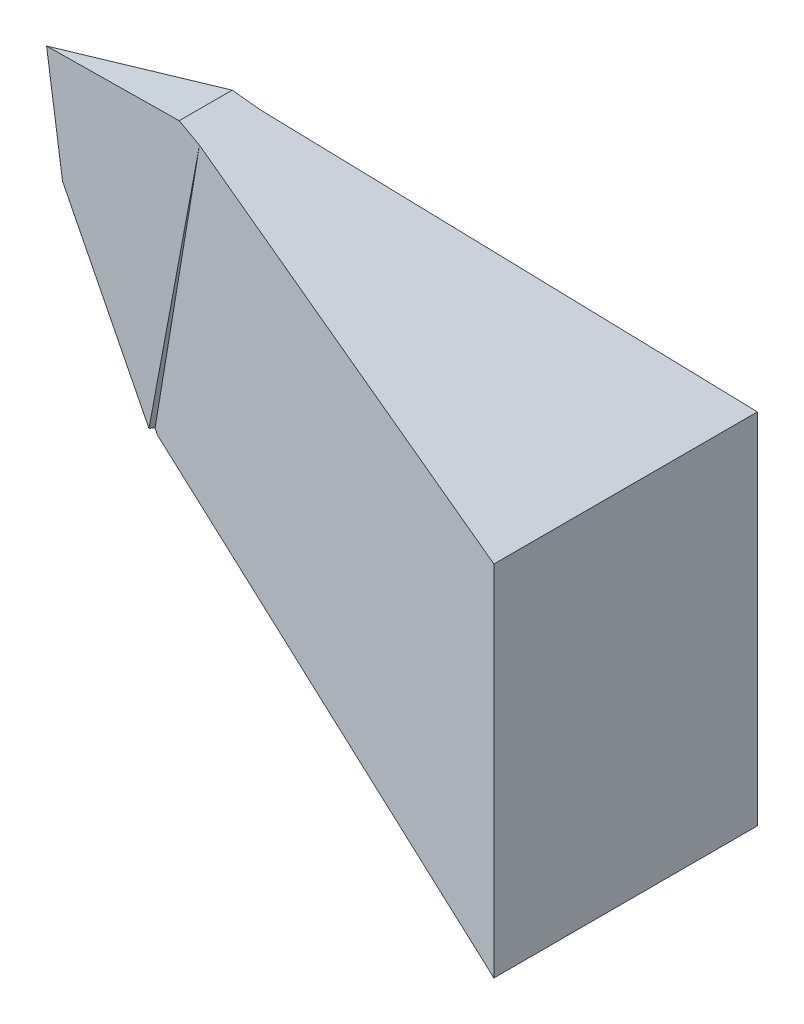
from build123d import *

# Parameters (mm, degrees)
BOSS_EXTRUDE1_DEPTH      = 821.33
BOSS_EXTRUDE1_DEPTH_BACK = 821.33
CUT_EXTRUDE1_DEPTH       = 1930.33
CUT_EXTRUDE2_DEPTH       = 3500.33
CUT_EXTRUDE4_DEPTH       = 3500.33


with BuildPart() as part:
    # Sketch1 → Boss-Extrude1 (new, two sides: drawn at the far end of the back side and taken through both)
    with BuildSketch(Plane.XY.offset(-BOSS_EXTRUDE1_DEPTH_BACK)):
        Polygon((0, 0), (-2819.61, 1161.48), (-3490.66, 2155.96), (-3609.78, 2815.96), (-2618, 2991), (0, 2235), align=None)
    extrude(amount=BOSS_EXTRUDE1_DEPTH + BOSS_EXTRUDE1_DEPTH_BACK)

    # Sketch4 → Cut-Extrude1 (cut)
    with BuildSketch(Plane(origin=(-197.210837788, 0, 770.878308588), x_dir=(-0.9687998649706745, 0, -0.2478443496083844), z_dir=(0.2478443496083844, 0, -0.9687998649706745))):
        Polygon((2731.63778727, 1161.48), (2332.756046829, 2991), (-203.561999664, 2235), (-203.561999664, 0), align=None)
    extrude(amount=-CUT_EXTRUDE1_DEPTH, mode=Mode.SUBTRACT)

    # Sketch5 → Cut-Extrude2 (cut)
    with BuildSketch(Plane(origin=(-197.210837788, 0, -770.878308588), x_dir=(-0.9687998649706745, 0, 0.2478443496083844), z_dir=(-0.2478443496083844, 0, -0.9687998649706745))):
        Polygon((-203.561999664, 0), (-203.561999664, 2235), (2332.756046829, 2991), (2706.853352309, 1161.48), align=None)
    extrude(amount=CUT_EXTRUDE2_DEPTH, mode=Mode.SUBTRACT)

    # Sketch7 → Cut-Extrude4 (cut)
    with BuildSketch(Plane(origin=(0, 0, 0), x_dir=(1, 0, 0), z_dir=(0, 1, 0))):
        Polygon((-3609.78, 1440.608861474), (-3609.78, 0), (-2465.886241537, 190.491790954), (-2674.067322956, 1440.608861474), align=None)
        Polygon((-2466.429596079, -190.352786648), (-3609.78, 0), (-3609.78, -1179.203815867), (-2465.886241537, -1179.203815867), align=None)
    extrude(amount=CUT_EXTRUDE4_DEPTH, mode=Mode.SUBTRACT)


solid = part.part
